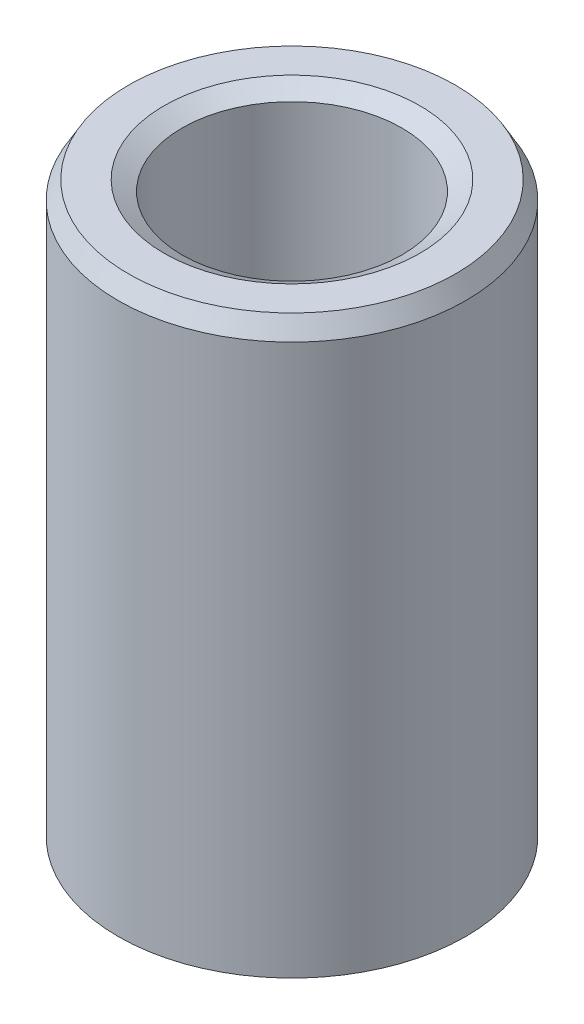
from build123d import *
from OCP.BRepFilletAPI import BRepFilletAPI_MakeChamfer

# Parameters (mm, degrees)
SKETCH1_R           = 37.5
BOSS_EXTRUDE1_DEPTH = 124.881797904
SKETCH2_R           = 23.716133744
CUT_EXTRUDE1_DEPTH  = 136.675950145
CHAMFER1_SIZE       = 3.86682727
CHAMFER1_SIZE2      = 2.232513765


with BuildPart() as part:
    # Sketch1 → Boss-Extrude1 (new body)
    with BuildSketch(Plane(origin=(0, 0, 0), x_dir=(1, 0, 0), z_dir=(0, 1, 0))):
        Circle(SKETCH1_R)
    extrude(amount=BOSS_EXTRUDE1_DEPTH)

    # Sketch2 → Cut-Extrude1 (cut, through all)
    with BuildSketch(Plane(origin=(0, 0, 0), x_dir=(1, 0, 0), z_dir=(0, 1, 0))):
        Circle(SKETCH2_R)
    extrude(amount=CUT_EXTRUDE1_DEPTH, mode=Mode.SUBTRACT)

    # Chamfer1: one chamfer whose edges measure the first distance from different faces: ONE call of the kernel's chamfer builder (chamfer() names one face for all edges)
    chamfer1_edges_1 = [part.edges().sort_by_distance(p)[0] for p in [
        (-23.716133744, 124.881797904, 0),
    ]]
    chamfer1_side_1 = [part.faces().sort_by_distance(p)[0] for p in [
        (-36.439339828, 124.881797904, 0),
    ]]
    chamfer1_edges_2 = [part.edges().sort_by_distance(p)[0] for p in [
        (-23.716133744, 0, 0),
    ]]
    chamfer1_side_2 = [part.faces().sort_by_distance(p)[0] for p in [
        (-23.716133744, 62.440898952, 0),
    ]]
    chamfer1_edges_3 = [part.edges().sort_by_distance(p)[0] for p in [
        (-37.5, 0, 0),
    ]]
    chamfer1_side_3 = [part.faces().sort_by_distance(p)[0] for p in [
        (-36.439339828, 0, 0),
    ]]
    chamfer1_edges_4 = [part.edges().sort_by_distance(p)[0] for p in [
        (-37.5, 124.881797904, 0),
    ]]
    chamfer1_side_4 = [part.faces().sort_by_distance(p)[0] for p in [
        (-37.5, 62.440898952, 0),
    ]]
    chamfer1 = BRepFilletAPI_MakeChamfer(part.part.solid().wrapped)
    for e in chamfer1_edges_1:
        chamfer1.Add(CHAMFER1_SIZE, CHAMFER1_SIZE2, e.wrapped, chamfer1_side_1[0].wrapped)  # the first distance lies on this face
    for e in chamfer1_edges_2:
        chamfer1.Add(CHAMFER1_SIZE, CHAMFER1_SIZE2, e.wrapped, chamfer1_side_2[0].wrapped)  # the first distance lies on this face
    for e in chamfer1_edges_3:
        chamfer1.Add(CHAMFER1_SIZE, CHAMFER1_SIZE2, e.wrapped, chamfer1_side_3[0].wrapped)  # the first distance lies on this face
    for e in chamfer1_edges_4:
        chamfer1.Add(CHAMFER1_SIZE, CHAMFER1_SIZE2, e.wrapped, chamfer1_side_4[0].wrapped)  # the first distance lies on this face
    add(Compound.cast(chamfer1.Shape()), mode=Mode.REPLACE)


solid = part.part
